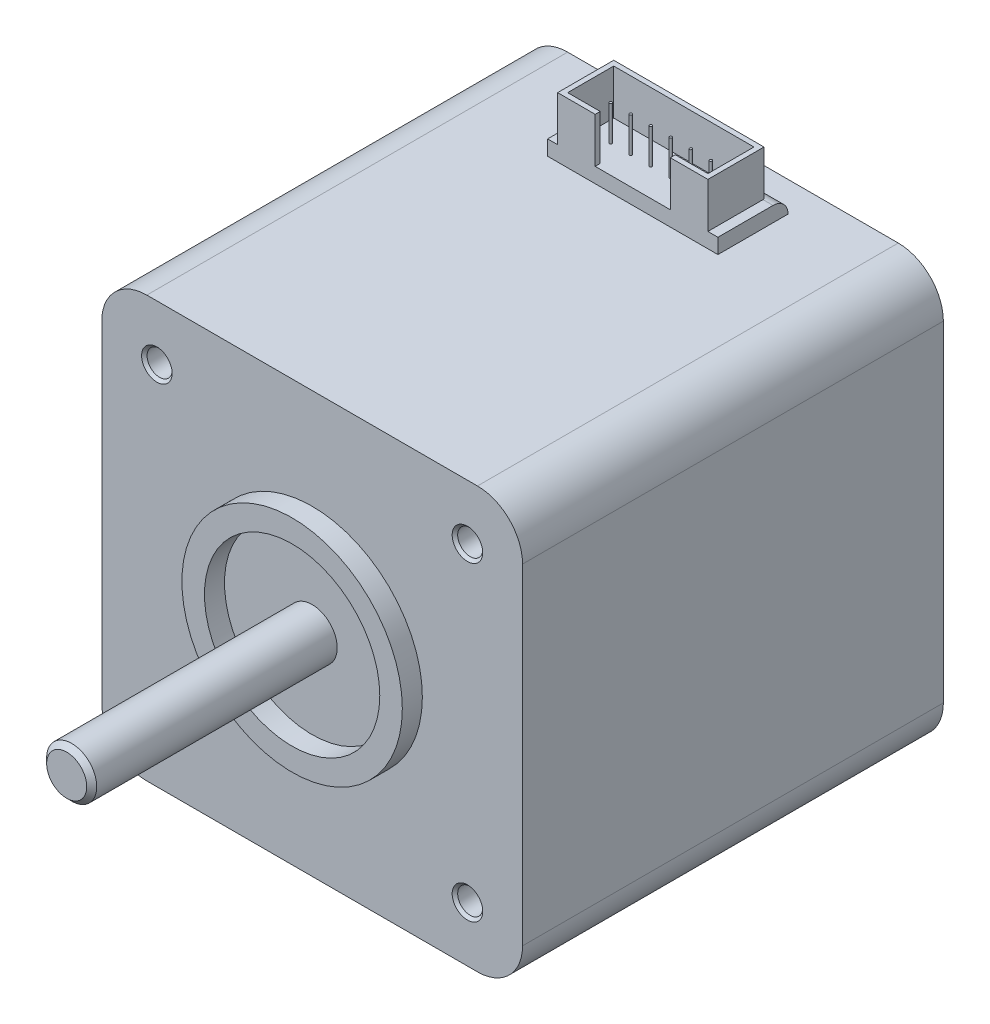
from build123d import *

# Parameters (mm, degrees)
SKETCH1_W                       = 42
SKETCH1_H                       = 42
BOSS_EXTRUDE2_DEPTH             = 8
SKETCH2_R                       = 11
BOSS_EXTRUDE3_DEPTH             = 2
SKETCH4_W                       = 42
SKETCH4_H                       = 42
BOSS_EXTRUDE5_DEPTH             = 24
SKETCH5_W                       = 42
SKETCH5_H                       = 42
BOSS_EXTRUDE6_DEPTH             = 10
FILLET1_R                       = 4.5
SKETCH7_R                       = 8.75
CUT_EXTRUDE1_DEPTH              = 2
CUT_EXTRUDE2_START              = -2
SKETCH8_R                       = 8.75
CUT_EXTRUDE2_DEPTH              = 2
SKETCH9_R                       = 2.5
BOSS_EXTRUDE9_DEPTH             = 24.5
CHAMFER2_SIZE                   = 0.5
M3X0_5_TAPPED_HOLE1_D           = 2.5
M3X0_5_TAPPED_HOLE1_DEPTH       = 5.75
M3X0_5_TAPPED_HOLE1_CSINK_D     = 3.05
M3X0_5_TAPPED_HOLE1_CSINK_ANGLE = 90
M3X0_5_TAPPED_HOLE1_TIP         = 0.751075774
SKETCH12_W                      = 17
SKETCH12_H                      = 7
BOSS_EXTRUDE10_DEPTH            = 1.5
FILLET2_R                       = 1.5
SKETCH13_W                      = 15
SKETCH13_H                      = 5.6
BOSS_EXTRUDE11_DEPTH            = 4.5
CUT_EXTRUDE3_DEPTH              = 4.5
SKETCH16_R                      = 0.125
BOSS_EXTRUDE12_DEPTH            = 3.5
LPATTERN1_COUNT                 = 6
LPATTERN1_PITCH                 = 2


with BuildPart() as part:
    # Sketch1 → Boss-Extrude2 (new body)
    with BuildSketch(Plane.XY):
        with Locations((-8.615384615, -1.788461538)):
            Rectangle(SKETCH1_W, SKETCH1_H)
    extrude(amount=BOSS_EXTRUDE2_DEPTH)

    # Sketch2 → Boss-Extrude3 (add)
    with BuildSketch(Plane.XY.offset(8)):
        with Locations((-8.615384615, -1.788461538)):
            Circle(SKETCH2_R)
    extrude(amount=BOSS_EXTRUDE3_DEPTH)

    # Sketch4 → Boss-Extrude5 (add)
    with BuildSketch(Plane(origin=(0, 0, 0), x_dir=(-1, 0, 0), z_dir=(0, 0, -1))):
        with Locations((8.615384615, -1.788461538)):
            Rectangle(SKETCH4_W, SKETCH4_H)
    extrude(amount=BOSS_EXTRUDE5_DEPTH)

    # Sketch5 → Boss-Extrude6 (add)
    with BuildSketch(Plane(origin=(0, 0, -24), x_dir=(-1, 0, 0), z_dir=(0, 0, -1))):
        with Locations((8.615384615, -1.788461538)):
            Rectangle(SKETCH5_W, SKETCH5_H)
    extrude(amount=BOSS_EXTRUDE6_DEPTH)

    # Fillet1
    fillet1_edges = [part.edges().sort_by_distance(p)[0] for p in [
        (-29.615384615, 19.211538462, -13),
        (12.384615385, 19.211538462, -13),
        (12.384615385, -22.788461538, -13),
        (-29.615384615, -22.788461538, -13),
    ]]
    fillet(fillet1_edges, radius=FILLET1_R)

    # Sketch7 → Cut-Extrude1 (cut)
    with BuildSketch(Plane(origin=(0, 0, -34), x_dir=(-1, 0, 0), z_dir=(0, 0, -1))):
        with Locations((8.615384615, -1.788461538)):
            Circle(SKETCH7_R)
    extrude(amount=-CUT_EXTRUDE1_DEPTH, mode=Mode.SUBTRACT)

    # Sketch8 → Cut-Extrude2 (cut)
    with BuildSketch(Plane.XY.offset(10).offset(CUT_EXTRUDE2_START)):
        with Locations(Location((-8.615384615, -1.788461538, 0), (0, 0, 180))):
            Circle(SKETCH8_R)
    extrude(amount=CUT_EXTRUDE2_DEPTH, mode=Mode.SUBTRACT)

    # Sketch9 → Boss-Extrude9 (add)
    with BuildSketch(Plane.XY.offset(8)):
        with Locations((-8.615384615, -1.788461538)):
            Circle(SKETCH9_R)
    extrude(amount=BOSS_EXTRUDE9_DEPTH)

    # Chamfer2
    chamfer2_edges = [part.edges().sort_by_distance(p)[0] for p in [
        (-11.115384615, -1.788461538, 32.5),
    ]]
    chamfer(chamfer2_edges, length=CHAMFER2_SIZE)

    # M3x0.5 Tapped Hole1
    with Locations(Plane(origin=(-24.115384615, 13.711538462, 8), x_dir=(1, 0, 0), z_dir=(0, 0, 1))):
        with Locations((0, 0), (31, 0), (31, -31), (0, -31)):
            CounterSinkHole(M3X0_5_TAPPED_HOLE1_D / 2, M3X0_5_TAPPED_HOLE1_CSINK_D / 2, depth=M3X0_5_TAPPED_HOLE1_DEPTH, counter_sink_angle=M3X0_5_TAPPED_HOLE1_CSINK_ANGLE)
            with Locations((0, 0, -(M3X0_5_TAPPED_HOLE1_DEPTH + M3X0_5_TAPPED_HOLE1_TIP / 2))):  # 118° drill point
                Cone(0, M3X0_5_TAPPED_HOLE1_D / 2, M3X0_5_TAPPED_HOLE1_TIP, mode=Mode.SUBTRACT)

    # Sketch12 → Boss-Extrude10 (add)
    with BuildSketch(Plane(origin=(0, 19.211538462, 0), x_dir=(1, 0, 0), z_dir=(0, 1, 0))):
        with Locations((-8.615384615, 27.5)):
            Rectangle(SKETCH12_W, SKETCH12_H)
    extrude(amount=BOSS_EXTRUDE10_DEPTH)

    # Fillet2
    fillet2_edges = [part.edges().sort_by_distance(p)[0] for p in [
        (-8.615384615, 20.711538462, -31),
    ]]
    fillet(fillet2_edges, radius=FILLET2_R - 0.0001)  # a hair under: the kernel refuses the full size

    # Sketch13 → Boss-Extrude11 (add)
    with BuildSketch(Plane(origin=(0, 20.711538462, 0), x_dir=(1, 0, 0), z_dir=(0, 1, 0))):
        with Locations((-8.615384615, 26.8)):
            Rectangle(SKETCH13_W, SKETCH13_H)
    extrude(amount=BOSS_EXTRUDE11_DEPTH)

    # Sketch15 → Cut-Extrude3 (cut)
    with BuildSketch(Plane(origin=(0, 25.211538462, 0), x_dir=(1, 0, 0), z_dir=(0, 1, 0))):
        Polygon((-12.365384615, 24), (-12.365384615, 24.5), (-15.615384615, 24.5), (-15.615384615, 29.1), (-1.615384615, 29.1), (-1.615384615, 24.5), (-4.865384615, 24.5), (-4.865384615, 24), align=None)
    extrude(amount=-CUT_EXTRUDE3_DEPTH, mode=Mode.SUBTRACT)

    # Sketch16 → Boss-Extrude12 (add)
    with BuildSketch(Plane(origin=(0, 20.711538462, 0), x_dir=(1, 0, 0), z_dir=(0, 1, 0))):
        with Locations(Location((-13.615384615, 26.8, 0), (0, 0, 90))):
            Circle(SKETCH16_R)
    boss_extrude12 = extrude(amount=BOSS_EXTRUDE12_DEPTH)

    # LPattern1: Boss-Extrude12 ×6
    with Locations(*[(i * LPATTERN1_PITCH, 0, 0) for i in range(1, LPATTERN1_COUNT)]):
        add(boss_extrude12)


solid = part.part
